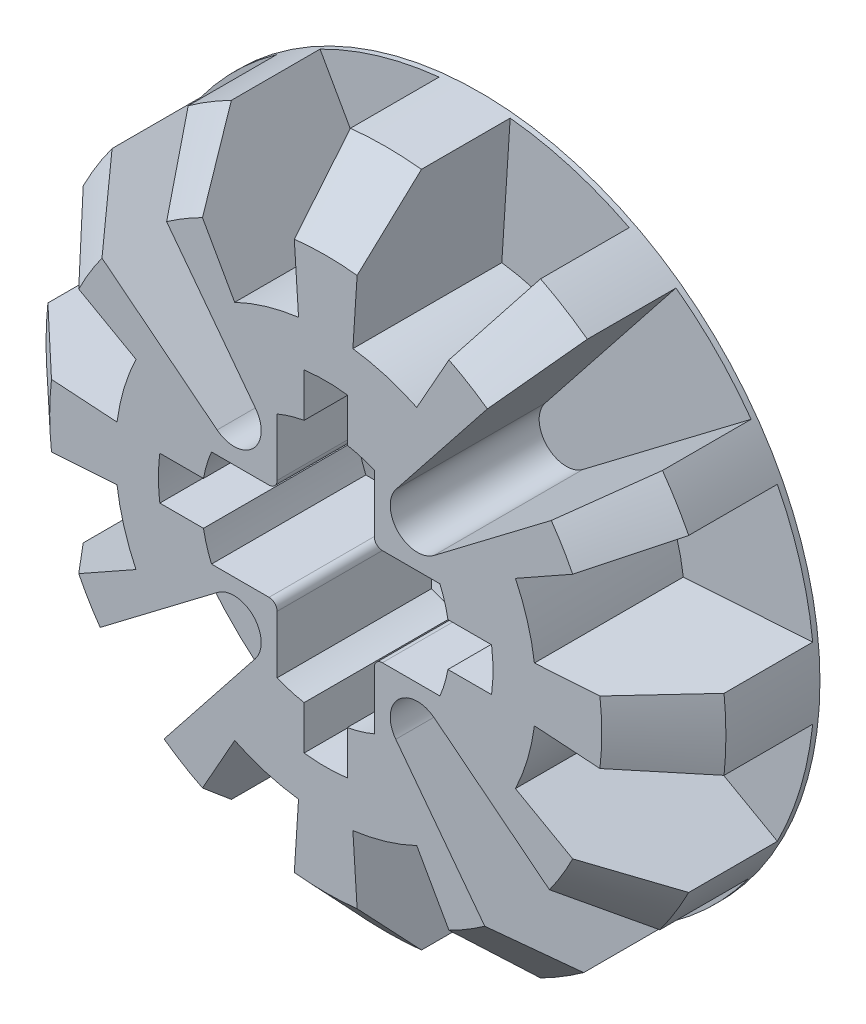
from build123d import *

# Parameters (mm, degrees)
SKETCH1_R           = 6.3
BOSS_EXTRUDE1_DEPTH = 2.86
BOSS_EXTRUDE2_START = 1.01
SKETCH2_R           = 4.1
SKETCH2_R_2         = 3.1
BOSS_EXTRUDE2_DEPTH = 1.01
CUT_EXTRUDE1_START  = -2.76
CUT_EXTRUDE1_DEPTH  = 2.76
CIRPATTERN1_COUNT   = 4


with BuildPart() as part:
    # Sketch1 → Boss-Extrude1 (new body)
    with BuildSketch(Plane.XY):
        Circle(SKETCH1_R)
        with BuildLine():
            Line((-1.05, -0.9), (-2.116601049, -0.9))
            ThreePointArc((-2.116601049, -0.9), (-2.204993905, -0.654218524), (-2.264950331, -0.4))
            Line((-2.264950331, -0.4), (-3.07408523, -0.4))
            ThreePointArc((-3.07408523, -0.4), (-3.1, 0), (-3.07408523, 0.4))
            Line((-3.07408523, 0.4), (-2.264950331, 0.4))
            ThreePointArc((-2.264950331, 0.4), (-2.204993905, 0.654218524), (-2.116601049, 0.9))
            Line((-2.116601049, 0.9), (-1.05, 0.9))
            ThreePointArc((-1.05, 0.9), (-0.943933983, 0.943933983), (-0.9, 1.05))
            Line((-0.9, 1.05), (-0.9, 2.116601049))
            ThreePointArc((-0.9, 2.116601049), (-0.654218524, 2.204993905), (-0.4, 2.264950331))
            Line((-0.4, 2.264950331), (-0.4, 3.07408523))
            ThreePointArc((-0.4, 3.07408523), (0, 3.1), (0.4, 3.07408523))
            Line((0.4, 3.07408523), (0.4, 2.264950331))
            ThreePointArc((0.4, 2.264950331), (0.654218524, 2.204993905), (0.9, 2.116601049))
            Line((0.9, 2.116601049), (0.9, 1.05))
            ThreePointArc((0.9, 1.05), (0.943933983, 0.943933983), (1.05, 0.9))
            Line((1.05, 0.9), (2.116601049, 0.9))
            ThreePointArc((2.116601049, 0.9), (2.204993905, 0.654218524), (2.264950331, 0.4))
            Line((2.264950331, 0.4), (3.07408523, 0.4))
            ThreePointArc((3.07408523, 0.4), (3.1, 0), (3.07408523, -0.4))
            Line((3.07408523, -0.4), (2.264950331, -0.4))
            ThreePointArc((2.264950331, -0.4), (2.204993905, -0.654218524), (2.116601049, -0.9))
            Line((2.116601049, -0.9), (1.05, -0.9))
            ThreePointArc((1.05, -0.9), (0.943933983, -0.943933983), (0.9, -1.05))
            Line((0.9, -1.05), (0.9, -2.116601049))
            ThreePointArc((0.9, -2.116601049), (0.654218524, -2.204993905), (0.4, -2.264950331))
            Line((0.4, -2.264950331), (0.4, -3.07408523))
            ThreePointArc((0.4, -3.07408523), (0, -3.1), (-0.4, -3.07408523))
            Line((-0.4, -3.07408523), (-0.4, -2.264950331))
            ThreePointArc((-0.4, -2.264950331), (-0.654218524, -2.204993905), (-0.9, -2.116601049))
            Line((-0.9, -2.116601049), (-0.9, -1.05))
            ThreePointArc((-0.9, -1.05), (-0.943933983, -0.943933983), (-1.05, -0.9))
        make_face(mode=Mode.SUBTRACT)
    extrude(amount=BOSS_EXTRUDE1_DEPTH)

    # Sketch2 → Boss-Extrude2 (add)
    with BuildSketch(Plane(origin=(0, 0, 0), x_dir=(-1, 0, 0), z_dir=(0, 0, -1)).offset(BOSS_EXTRUDE2_START)):
        Circle(SKETCH2_R)
        Circle(SKETCH2_R_2, mode=Mode.SUBTRACT)
    extrude(amount=-BOSS_EXTRUDE2_DEPTH)

    # Sketch3 → Cut-Extrude1 (cut)
    with BuildSketch(Plane.XY.offset(2.86).offset(CUT_EXTRUDE1_START)):
        with BuildLine():
            ThreePointArc((-1.687138839, 3.516185794), (-1.109327063, 3.738902709), (-0.503547315, 3.867355699))
            Line((-0.503547315, 3.867355699), (-0.658514541, 6.265489494))
            ThreePointArc((-0.658514541, 6.265489494), (-1.791989871, 6.039765915), (-2.865158016, 5.610781545))
            Line((-2.865158016, 5.610781545), (-1.687138839, 3.516185794))
        make_face()
        with BuildLine():
            Line((1.298290287, -2.004404983), (3.664644204, -5.124488546))
            ThreePointArc((3.664644204, -5.124488546), (4.425231419, -4.48411941), (5.075598647, -3.732063554))
            Line((5.075598647, -3.732063554), (2.012879929, -1.304861101))
            ThreePointArc((2.012879929, -1.304861101), (1.347288977, -1.339706092), (1.298290287, -2.004404983))
        make_face()
        with BuildLine():
            ThreePointArc((-3.867355699, 0.503547315), (-3.738902709, 1.109327063), (-3.516185794, 1.687138839))
            Line((-3.516185794, 1.687138839), (-5.610781545, 2.865158016))
            ThreePointArc((-5.610781545, 2.865158016), (-6.039765915, 1.791989871), (-6.265489494, 0.658514541))
            Line((-6.265489494, 0.658514541), (-3.867355699, 0.503547315))
        make_face()
    cut_extrude1 = extrude(amount=CUT_EXTRUDE1_DEPTH, mode=Mode.SUBTRACT)

    # CirPattern1: Cut-Extrude1 ×4 about axis
    cirpattern1_axis = Axis((0, 0, 2.86), (0, 0, 1))
    for i in range(1, CIRPATTERN1_COUNT):
        add(cut_extrude1.rotate(cirpattern1_axis, i * 360 / CIRPATTERN1_COUNT), mode=Mode.SUBTRACT)

    # Sketch5 → Cut-Revolve1 (revolve, cut)
    with BuildSketch(Plane(origin=(0, 0, 0), x_dir=(1, 0, 0), z_dir=(0, 1, 0))):
        Polygon((-6.59, -3.11), (-6.59, -1.47), (-4.85, -3.11), align=None)
    revolve(axis=Axis((0, 0, -2.797897232), (0, 0, 1)), mode=Mode.SUBTRACT)


solid = part.part
